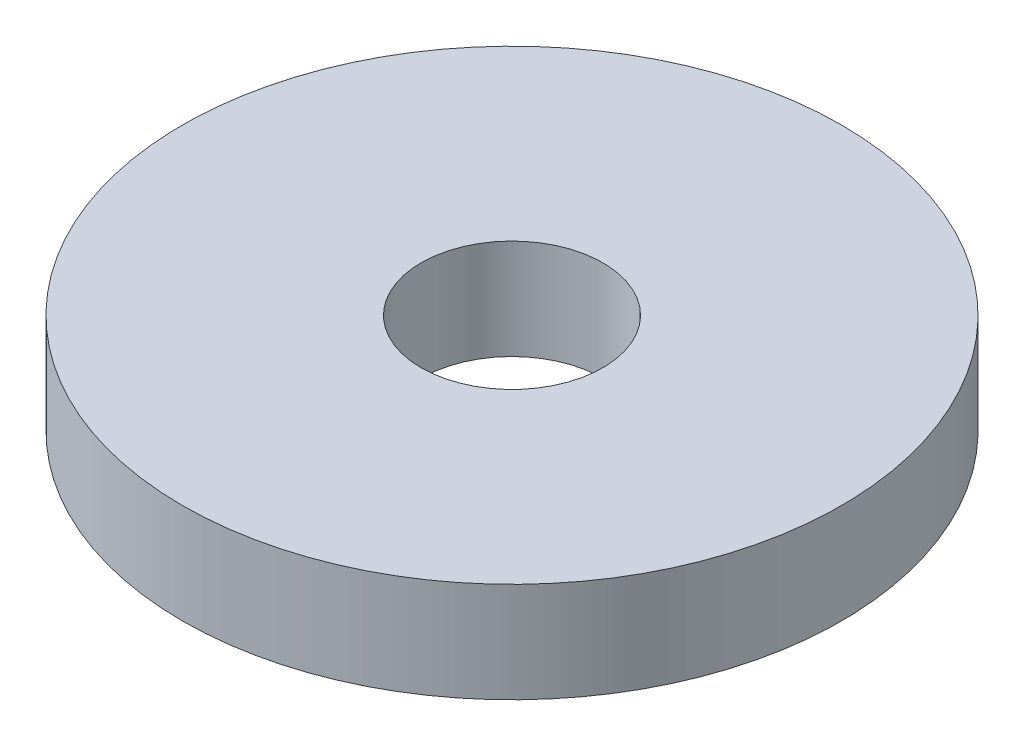
from build123d import *

# Parameters (mm, degrees)
SKETCH1_R           = 72.5
BOSS_EXTRUDE1_DEPTH = 22
SKETCH2_R           = 20
CUT_EXTRUDE1_DEPTH  = 105.864197894


with BuildPart() as part:
    # Sketch1 → Boss-Extrude1 (new body)
    with BuildSketch(Plane(origin=(0, 0, 0), x_dir=(1, 0, 0), z_dir=(0, 1, 0))):
        Circle(SKETCH1_R)
    extrude(amount=BOSS_EXTRUDE1_DEPTH)

    # Sketch2 → Cut-Extrude1 (cut, through all)
    with BuildSketch(Plane(origin=(0, 0, 0), x_dir=(1, 0, 0), z_dir=(0, 1, 0))):
        Circle(SKETCH2_R)
    extrude(amount=CUT_EXTRUDE1_DEPTH, mode=Mode.SUBTRACT)


solid = part.part
